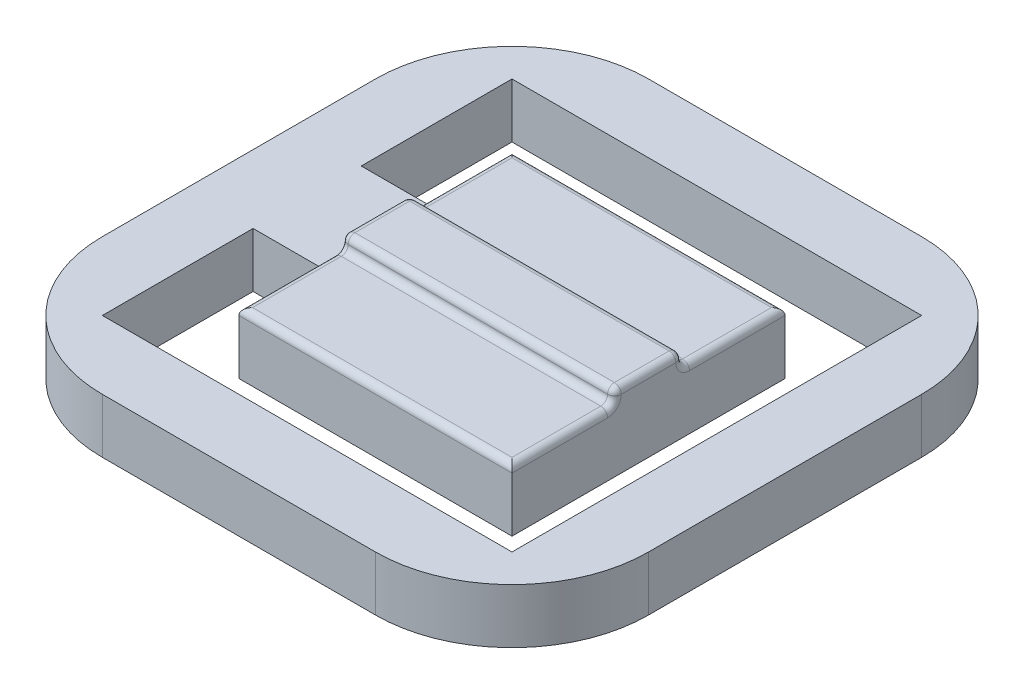
from build123d import *

# Parameters (mm, degrees)
EXTRUDE_1_DEPTH = 4
EXTRUDE_2_DEPTH = 20
FILLET_1_R      = 0.5
FILLET_2_R      = 0.5


with BuildPart() as part:
    # 草图1 → 凸台-拉伸1 (new body)
    with BuildSketch(Plane(origin=(0, 0, 0), x_dir=(1, 0, 0), z_dir=(0, 1, 0))):
        with BuildLine():
            Line((-10, -20), (10, -20))
            ThreePointArc((10, -20), (17.071067812, -17.071067812), (20, -10))
            Line((20, -10), (20, 10))
            ThreePointArc((20, 10), (17.071067812, 17.071067812), (10, 20))
            Line((10, 20), (-10, 20))
            ThreePointArc((-10, 20), (-17.071067812, 17.071067812), (-20, 10))
            Line((-20, 10), (-20, -10))
            ThreePointArc((-20, -10), (-17.071067812, -17.071067812), (-10, -20))
        make_face()
        Polygon((-10, 3.960573477), (-15, 3.960573477), (-15, 15), (15, 15), (15, -15), (-15, -15), (-15, -3.960573477), (-10, -3.960573477), (-10, -10), (10, -10), (10, 10), (-10, 10), align=None, mode=Mode.SUBTRACT)
    extrude(amount=EXTRUDE_1_DEPTH)

    # 草图2 → 凸台-拉伸2 (add)
    with BuildSketch(Plane.ZY.offset(10)):
        Polygon((-10, 4), (10, 4), (10, 4.5), (2.5, 4.5), (2.5, 5.5), (-2.5, 5.5), (-2.5, 4.5), (-10, 4.5), align=None)
    extrude(amount=-EXTRUDE_2_DEPTH)

    # 圆角1
    fillet_1_edges = [part.edges().sort_by_distance(p)[0] for p in [
        (10, 4.5, -6.25),
        (0, 4.5, -10),
        (10, 5, -2.5),
        (0, 4.5, -2.5),
        (10, 5, 2.5),
        (10, 4.5, 6.25),
        (0, 4.5, 2.5),
        (0, 4.5, 10),
        (-10, 4.5, 6.25),
        (-10, 5, 2.5),
        (-10, 5, -2.5),
        (-10, 4.5, -6.25),
    ]]
    fillet(fillet_1_edges, radius=FILLET_1_R - 0.0001)  # a hair under: the kernel refuses the full size

    # 圆角2
    fillet_2_edges = [part.edges().sort_by_distance(p)[0] for p in [
        (9.85358268, 5.5, 2.35358268),
        (0, 5.5, 2.5),
        (-9.85358268, 5.5, 2.35358268),
        (-10, 5.5, 0),
        (-9.85358268, 5.5, -2.35358268),
        (0, 5.5, -2.5),
        (9.85358268, 5.5, -2.35358268),
        (10, 5.5, 0),
    ]]
    fillet(fillet_2_edges, radius=FILLET_2_R - 0.0001)  # a hair under: the kernel refuses the full size


solid = part.part
